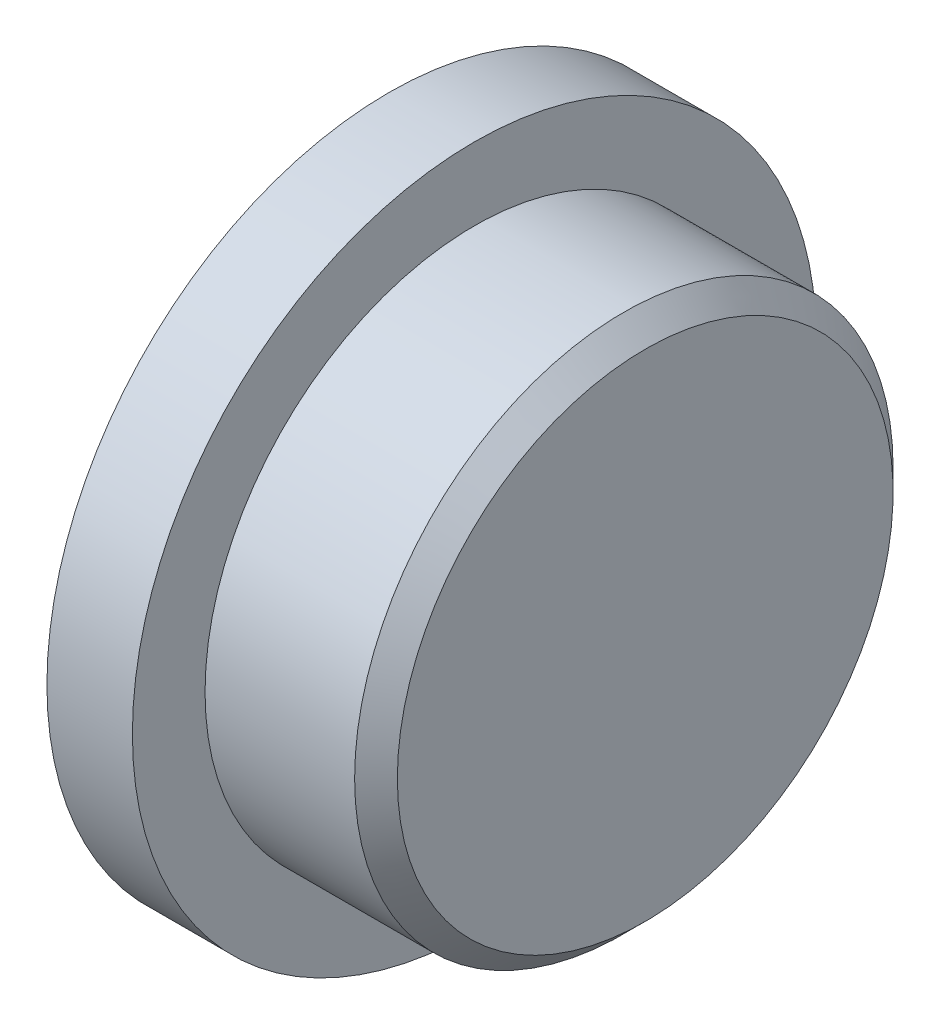
from build123d import *

# Parameters (mm, degrees)
CHAMFER1_SIZE = 0.25


with BuildPart() as part:
    # Sketch2 → Revolve1 (revolve)
    with BuildSketch(Plane.XY):
        Polygon((0, 0), (3, 0), (3, 3.15), (1, 3.15), (1, 4), (0, 4), align=None)
    revolve(axis=Axis((0, 0, 0), (1, 0, 0)))

    # Chamfer1
    chamfer1_edges = [part.edges().sort_by_distance(p)[0] for p in [
        (3, -3.15, 0),
    ]]
    chamfer(chamfer1_edges, length=CHAMFER1_SIZE)


solid = part.part
